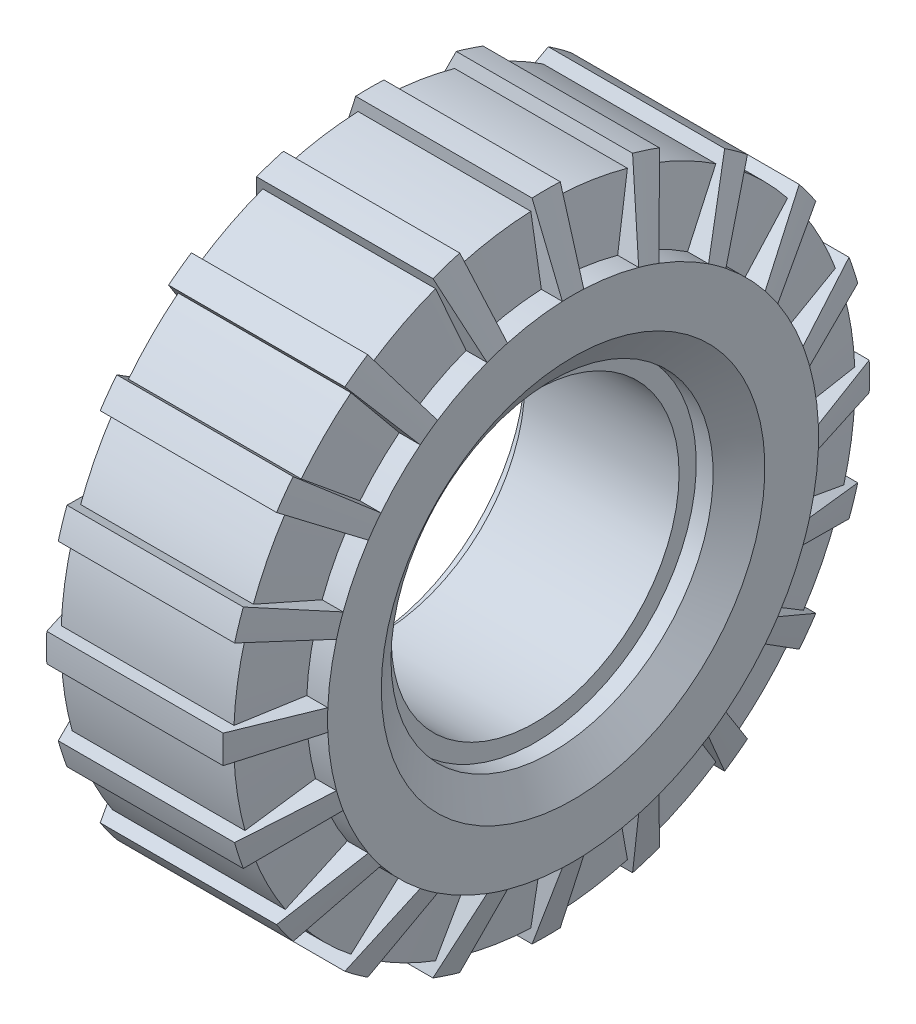
from build123d import *

# Parameters (mm, degrees)
REVOLVE2_ANGLE     = 5
SKETCH3_R          = 23.758691232
SKETCH3_R_2        = 21.074295932
CUT_EXTRUDE3_DEPTH = 10
CIRPATTERN7_COUNT  = 20


# Read off the part's stored shape, not the designer's step: Revolve2
with BuildPart() as part:
    # Sketch1 → Revolve1 (revolve)
    with BuildSketch(Plane.XY, mode=Mode.PRIVATE) as revolve1_sk:
        Polygon((5.63, 20.25), (0, 20.25), (0, 9.38), (5.03, 9.38), (5.03, 10.5), (6.13, 10.5), (7.5, 12.5), (7.5, 16), (6.13, 16), align=None)
    revolve(revolve1_sk.sketch.rotate(Axis((0, 0, 0), (1, 0, 0)), 90), axis=Axis((0, 0, 0), (1, 0, 0)))

    # Revolve2 outline → Revolve2 (revolve)
    with BuildSketch(Plane(origin=(0, 0, 0), x_dir=(0, 0.9990482215818578, -0.04361938736533611), z_dir=(0, -0.04361938736533611, -0.9990482215818578))):
        Polygon((21.074295932, 5.747004913), (16, 7.5), (16, 0), (21.5, 0), align=None)
    revolve2 = revolve(axis=Axis((0, 0, 0), (1, 0, 0)), revolution_arc=REVOLVE2_ANGLE)

    # Sketch3 → Cut-Extrude3 (cut)
    with BuildSketch(Plane(origin=(0, 0, 0), x_dir=(0, 0, -1), z_dir=(1, 0, 0))):
        Circle(SKETCH3_R)
        Circle(SKETCH3_R_2, mode=Mode.SUBTRACT)
    cut_extrude3 = extrude(amount=CUT_EXTRUDE3_DEPTH, mode=Mode.SUBTRACT)

    # CirPattern7: Revolve2, Cut-Extrude3 ×20 about axis
    cirpattern7_axis = Axis((0, 0, 0), (1, 0, 0))
    add([revolve2.rotate(cirpattern7_axis, i * 360 / CIRPATTERN7_COUNT) for i in range(1, CIRPATTERN7_COUNT)])
    add([cut_extrude3.rotate(cirpattern7_axis, i * 360 / CIRPATTERN7_COUNT) for i in range(1, CIRPATTERN7_COUNT)], mode=Mode.SUBTRACT)

    # Mirror2: part across plane


with BuildPart() as part_1:
    add(part.part)
    add(part.part.mirror(Plane(origin=(0, 0, 0), x_dir=(0, 0, 1), z_dir=(1, 0, 0))))


solid = part_1.part
